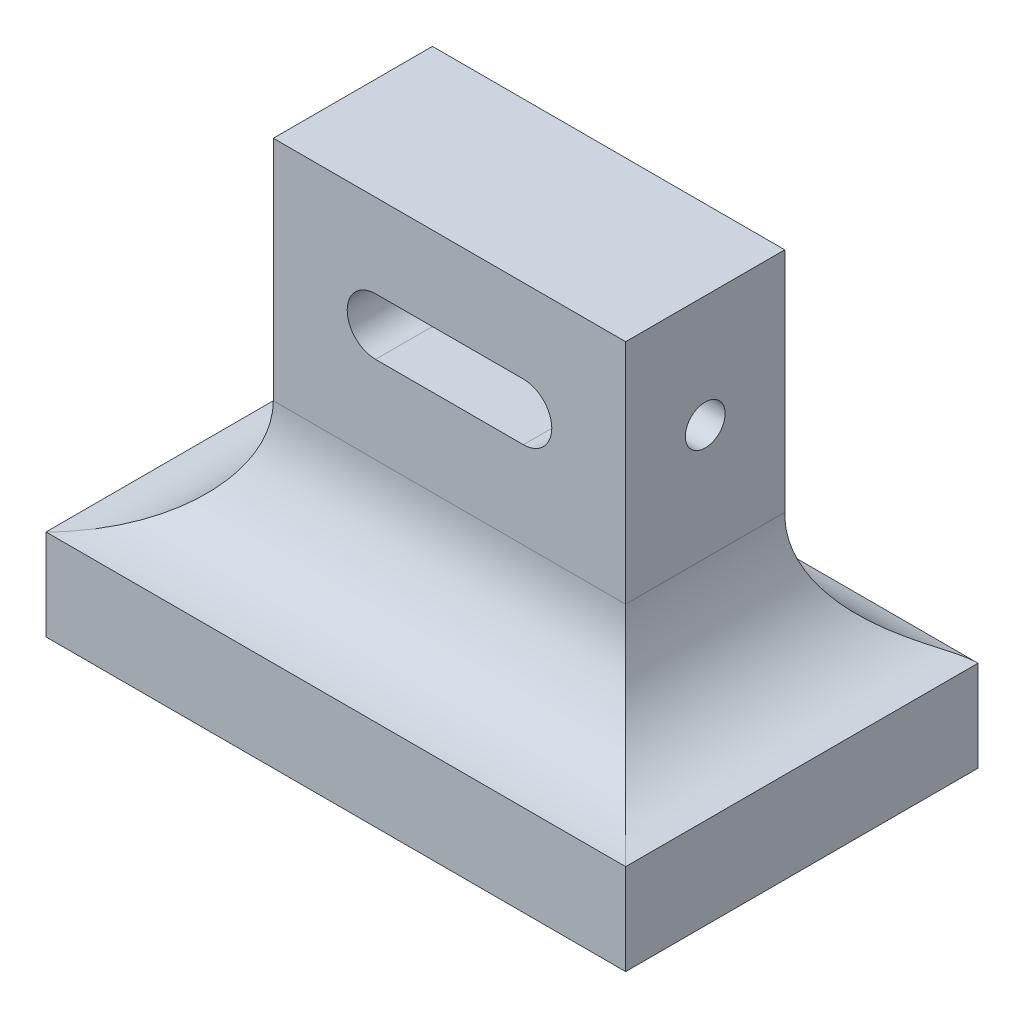
from build123d import *

# Parameters (mm, degrees)
SKETCH1_W                               = 51
SKETCH1_H                               = 31
BOSS_EXTRUDE1_DEPTH                     = 8
SKETCH5_W                               = 31
SKETCH5_H                               = 14
BOSS_EXTRUDE3_DEPTH                     = 30
CUT_EXTRUDE3_DEPTH                      = 68.977937597
FILLET1_R                               = 10
SKETCH8_R                               = 1.75
F_3_5MM_SCREW_HOLE_FOR_TENSIONING_DEPTH = 64.921827371


with BuildPart() as part:
    # Sketch1 → Boss-Extrude1 (new body)
    with BuildSketch(Plane(origin=(0, 0, 0), x_dir=(1, 0, 0), z_dir=(0, 1, 0))):
        with Locations((25.5, 15.5)):
            Rectangle(SKETCH1_W, SKETCH1_H)
    extrude(amount=BOSS_EXTRUDE1_DEPTH)

    # Sketch5 → Boss-Extrude3 (add)
    with BuildSketch(Plane(origin=(0, 8, 0), x_dir=(1, 0, 0), z_dir=(0, 1, 0))):
        with Locations((25.5, 17)):
            Rectangle(SKETCH5_W, SKETCH5_H)
    extrude(amount=BOSS_EXTRUDE3_DEPTH)

    # Sketch6 → Cut-Extrude3 (cut, through all)
    with BuildSketch(Plane(origin=(0, 0, -24), x_dir=(-1, 0, 0), z_dir=(0, 0, -1))):
        with BuildLine():
            Line((-32.000000097, 30.65), (-18.999999903, 30.65))
            ThreePointArc((-18.999999903, 30.65), (-16.499999903, 28.15), (-18.999999903, 25.65))
            Line((-18.999999903, 25.65), (-32.000000097, 25.65))
            ThreePointArc((-32.000000097, 25.65), (-34.500000097, 28.15), (-32.000000097, 30.65))
        make_face()
    extrude(amount=-CUT_EXTRUDE3_DEPTH, mode=Mode.SUBTRACT)

    # Fillet1
    # the kernel refuses this fillet: 10 mm, written as the material it adds along each edge
    with BuildSketch(Plane(origin=(41, 8, -24), x_dir=(0, 0, -1), z_dir=(-1, 0, 0))) as fillet1_piece_1:
        with BuildLine():
            CenterArc((10, -9.539392014), FILLET1_R, 107.457603124, 72.542396876)
            Line((0, -9.539392014), (-0.2, -9.539392014))
            Line((-0.2, -9.539392014), (-0.2, 0))
            Line((-0.2, 0), (0, 0.2))
            ThreePointArc((0, 0.2), (3.5, 0.2), (6.94, 0.19078784))
            Line((6.94, 0.19078784), (7, 0))
        make_face()
    extrude(amount=31)
    with BuildSketch(Plane(origin=(10, 8, -24), x_dir=(-1, 0, 0), z_dir=(0, 0, 1)), Plane(origin=(41, 8, -10), x_dir=(1, 0, 0), z_dir=(0, 0, -1))) as fillet1_piece_2:
        with BuildLine():
            CenterArc((FILLET1_R, -FILLET1_R), FILLET1_R, 90, 90)
            Line((0, -FILLET1_R), (-FILLET1_R * 0.02, -FILLET1_R))
            Line((-FILLET1_R * 0.02, -FILLET1_R), (-FILLET1_R * 0.02, FILLET1_R * 0.02))
            Line((-FILLET1_R * 0.02, FILLET1_R * 0.02), (FILLET1_R, FILLET1_R * 0.02))
            Line((FILLET1_R, FILLET1_R * 0.02), (FILLET1_R, 0))
        make_face()
    extrude(amount=14)
    with BuildSketch(Plane(origin=(10, 8, -10), x_dir=(0, 0, 1), z_dir=(1, 0, 0))) as fillet1_piece_3:
        with BuildLine():
            CenterArc((FILLET1_R, -FILLET1_R), FILLET1_R, 90, 90)
            Line((0, -FILLET1_R), (-FILLET1_R * 0.02, -FILLET1_R))
            Line((-FILLET1_R * 0.02, -FILLET1_R), (-FILLET1_R * 0.02, FILLET1_R * 0.02))
            Line((-FILLET1_R * 0.02, FILLET1_R * 0.02), (FILLET1_R, FILLET1_R * 0.02))
            Line((FILLET1_R, FILLET1_R * 0.02), (FILLET1_R, 0))
        make_face()
    extrude(amount=31)
    with BuildSketch(Plane(origin=(64.848480035, 8, -24), x_dir=(0, 0, -1), z_dir=(-1, 0, 0))) as fillet1_piece_4a_section:
        with BuildLine():
            CenterArc((10, -9.539392014), FILLET1_R, 107.457603124, 72.542396876)
            Line((0, -9.539392014), (-0.2, -9.539392014))
            Line((-0.2, -9.539392014), (-0.2, 0))
            Line((-0.2, 0), (0, 0.2))
            ThreePointArc((0, 0.2), (3.5, 0.2), (6.94, 0.19078784))
            Line((6.94, 0.19078784), (7, 0))
        make_face()
    fillet1_piece_4a = extrude(amount=54.848480035, mode=Mode.PRIVATE)
    fillet1_piece_4a = split(fillet1_piece_4a, bisect_by=Plane(origin=(51, 10.271225878, -25.787817996), z_dir=(-1, 0, 0)), keep=Keep.TOP, mode=Mode.PRIVATE)
    fillet1_piece_4a = split(fillet1_piece_4a, bisect_by=Plane(origin=(41, 10.271225878, -25.787817996), z_dir=(1, 0, 0)), keep=Keep.TOP, mode=Mode.PRIVATE)
    with BuildSketch(Plane(origin=(41, 8, -10), x_dir=(1, 0, 0), z_dir=(0, 0, -1))) as fillet1_piece_4b_section:
        with BuildLine():
            CenterArc((FILLET1_R, -FILLET1_R), FILLET1_R, 90, 90)
            Line((0, -FILLET1_R), (-FILLET1_R * 0.02, -FILLET1_R))
            Line((-FILLET1_R * 0.02, -FILLET1_R), (-FILLET1_R * 0.02, FILLET1_R * 0.02))
            Line((-FILLET1_R * 0.02, FILLET1_R * 0.02), (FILLET1_R, FILLET1_R * 0.02))
            Line((FILLET1_R, FILLET1_R * 0.02), (FILLET1_R, 0))
        make_face()
    fillet1_piece_4b = extrude(amount=39, mode=Mode.PRIVATE)
    fillet1_piece_4b = split(fillet1_piece_4b, bisect_by=Plane(origin=(43.263951143, 10.263951143, -31), z_dir=(0, 0, 1)), keep=Keep.TOP, mode=Mode.PRIVATE)
    fillet1_piece_4b = split(fillet1_piece_4b, bisect_by=Plane(origin=(43.263951143, 10.263951143, -24), z_dir=(0, 0, -1)), keep=Keep.TOP, mode=Mode.PRIVATE)
    fillet1_piece_4 = fillet1_piece_4a & fillet1_piece_4b
    add(fillet1_piece_4)
    with BuildSketch(Plane(origin=(41, 8, -24), x_dir=(0, 0, -1), z_dir=(-1, 0, 0))) as fillet1_piece_5a_section:
        with BuildLine():
            CenterArc((10, -9.539392014), FILLET1_R, 107.457603124, 72.542396876)
            Line((0, -9.539392014), (-0.2, -9.539392014))
            Line((-0.2, -9.539392014), (-0.2, 0))
            Line((-0.2, 0), (0, 0.2))
            ThreePointArc((0, 0.2), (3.5, 0.2), (6.94, 0.19078784))
            Line((6.94, 0.19078784), (7, 0))
        make_face()
    fillet1_piece_5a = extrude(amount=54.848480035, mode=Mode.PRIVATE)
    fillet1_piece_5a = split(fillet1_piece_5a, bisect_by=Plane(origin=(0, 10.271225878, -25.787817996), z_dir=(1, 0, 0)), keep=Keep.TOP, mode=Mode.PRIVATE)
    fillet1_piece_5a = split(fillet1_piece_5a, bisect_by=Plane(origin=(10, 10.271225878, -25.787817996), z_dir=(-1, 0, 0)), keep=Keep.TOP, mode=Mode.PRIVATE)
    with BuildSketch(Plane(origin=(10, 8, -49), x_dir=(-1, 0, 0), z_dir=(0, 0, 1))) as fillet1_piece_5b_section:
        with BuildLine():
            CenterArc((FILLET1_R, -FILLET1_R), FILLET1_R, 90, 90)
            Line((0, -FILLET1_R), (-FILLET1_R * 0.02, -FILLET1_R))
            Line((-FILLET1_R * 0.02, -FILLET1_R), (-FILLET1_R * 0.02, FILLET1_R * 0.02))
            Line((-FILLET1_R * 0.02, FILLET1_R * 0.02), (FILLET1_R, FILLET1_R * 0.02))
            Line((FILLET1_R, FILLET1_R * 0.02), (FILLET1_R, 0))
        make_face()
    fillet1_piece_5b = extrude(amount=39, mode=Mode.PRIVATE)
    fillet1_piece_5b = split(fillet1_piece_5b, bisect_by=Plane(origin=(7.736048857, 10.263951143, -31), z_dir=(0, 0, 1)), keep=Keep.TOP, mode=Mode.PRIVATE)
    fillet1_piece_5b = split(fillet1_piece_5b, bisect_by=Plane(origin=(7.736048857, 10.263951143, -24), z_dir=(0, 0, -1)), keep=Keep.TOP, mode=Mode.PRIVATE)
    fillet1_piece_5 = fillet1_piece_5a & fillet1_piece_5b
    add(fillet1_piece_5)
    with BuildSketch(Plane(origin=(10, 8, -24), x_dir=(-1, 0, 0), z_dir=(0, 0, 1))) as fillet1_piece_6a_section:
        with BuildLine():
            CenterArc((FILLET1_R, -FILLET1_R), FILLET1_R, 90, 90)
            Line((0, -FILLET1_R), (-FILLET1_R * 0.02, -FILLET1_R))
            Line((-FILLET1_R * 0.02, -FILLET1_R), (-FILLET1_R * 0.02, FILLET1_R * 0.02))
            Line((-FILLET1_R * 0.02, FILLET1_R * 0.02), (FILLET1_R, FILLET1_R * 0.02))
            Line((FILLET1_R, FILLET1_R * 0.02), (FILLET1_R, 0))
        make_face()
    fillet1_piece_6a = extrude(amount=39, mode=Mode.PRIVATE)
    fillet1_piece_6a = split(fillet1_piece_6a, bisect_by=Plane(origin=(7.736048857, 10.263951143, 0), z_dir=(0, 0, -1)), keep=Keep.TOP, mode=Mode.PRIVATE)
    fillet1_piece_6a = split(fillet1_piece_6a, bisect_by=Plane(origin=(7.736048857, 10.263951143, -10), z_dir=(0, 0, 1)), keep=Keep.TOP, mode=Mode.PRIVATE)
    with BuildSketch(Plane(origin=(-15, 8, -10), x_dir=(0, 0, 1), z_dir=(1, 0, 0))) as fillet1_piece_6b_section:
        with BuildLine():
            CenterArc((FILLET1_R, -FILLET1_R), FILLET1_R, 90, 90)
            Line((0, -FILLET1_R), (-FILLET1_R * 0.02, -FILLET1_R))
            Line((-FILLET1_R * 0.02, -FILLET1_R), (-FILLET1_R * 0.02, FILLET1_R * 0.02))
            Line((-FILLET1_R * 0.02, FILLET1_R * 0.02), (FILLET1_R, FILLET1_R * 0.02))
            Line((FILLET1_R, FILLET1_R * 0.02), (FILLET1_R, 0))
        make_face()
    fillet1_piece_6b = extrude(amount=56, mode=Mode.PRIVATE)
    fillet1_piece_6b = split(fillet1_piece_6b, bisect_by=Plane(origin=(0, 10.263951143, -7.736048857), z_dir=(1, 0, 0)), keep=Keep.TOP, mode=Mode.PRIVATE)
    fillet1_piece_6b = split(fillet1_piece_6b, bisect_by=Plane(origin=(10, 10.263951143, -7.736048857), z_dir=(-1, 0, 0)), keep=Keep.TOP, mode=Mode.PRIVATE)
    fillet1_piece_6 = fillet1_piece_6a & fillet1_piece_6b
    add(fillet1_piece_6)
    with BuildSketch(Plane(origin=(10, 8, -10), x_dir=(0, 0, 1), z_dir=(1, 0, 0))) as fillet1_piece_7a_section:
        with BuildLine():
            CenterArc((FILLET1_R, -FILLET1_R), FILLET1_R, 90, 90)
            Line((0, -FILLET1_R), (-FILLET1_R * 0.02, -FILLET1_R))
            Line((-FILLET1_R * 0.02, -FILLET1_R), (-FILLET1_R * 0.02, FILLET1_R * 0.02))
            Line((-FILLET1_R * 0.02, FILLET1_R * 0.02), (FILLET1_R, FILLET1_R * 0.02))
            Line((FILLET1_R, FILLET1_R * 0.02), (FILLET1_R, 0))
        make_face()
    fillet1_piece_7a = extrude(amount=56, mode=Mode.PRIVATE)
    fillet1_piece_7a = split(fillet1_piece_7a, bisect_by=Plane(origin=(51, 10.263951143, -7.736048857), z_dir=(-1, 0, 0)), keep=Keep.TOP, mode=Mode.PRIVATE)
    fillet1_piece_7a = split(fillet1_piece_7a, bisect_by=Plane(origin=(41, 10.263951143, -7.736048857), z_dir=(1, 0, 0)), keep=Keep.TOP, mode=Mode.PRIVATE)
    with BuildSketch(Plane(origin=(41, 8, 15), x_dir=(1, 0, 0), z_dir=(0, 0, -1))) as fillet1_piece_7b_section:
        with BuildLine():
            CenterArc((FILLET1_R, -FILLET1_R), FILLET1_R, 90, 90)
            Line((0, -FILLET1_R), (-FILLET1_R * 0.02, -FILLET1_R))
            Line((-FILLET1_R * 0.02, -FILLET1_R), (-FILLET1_R * 0.02, FILLET1_R * 0.02))
            Line((-FILLET1_R * 0.02, FILLET1_R * 0.02), (FILLET1_R, FILLET1_R * 0.02))
            Line((FILLET1_R, FILLET1_R * 0.02), (FILLET1_R, 0))
        make_face()
    fillet1_piece_7b = extrude(amount=39, mode=Mode.PRIVATE)
    fillet1_piece_7b = split(fillet1_piece_7b, bisect_by=Plane(origin=(43.263951143, 10.263951143, 0), z_dir=(0, 0, -1)), keep=Keep.TOP, mode=Mode.PRIVATE)
    fillet1_piece_7b = split(fillet1_piece_7b, bisect_by=Plane(origin=(43.263951143, 10.263951143, -10), z_dir=(0, 0, 1)), keep=Keep.TOP, mode=Mode.PRIVATE)
    fillet1_piece_7 = fillet1_piece_7a & fillet1_piece_7b
    add(fillet1_piece_7)

    # Sketch8 → 3.5mm screw hole for tensioning (cut, through all)
    with BuildSketch(Plane(origin=(41, 0, 0), x_dir=(0, 0, -1), z_dir=(1, 0, 0))):
        with Locations((17, 28.15)):
            Circle(SKETCH8_R)
    extrude(amount=-F_3_5MM_SCREW_HOLE_FOR_TENSIONING_DEPTH, mode=Mode.SUBTRACT)


solid = part.part
